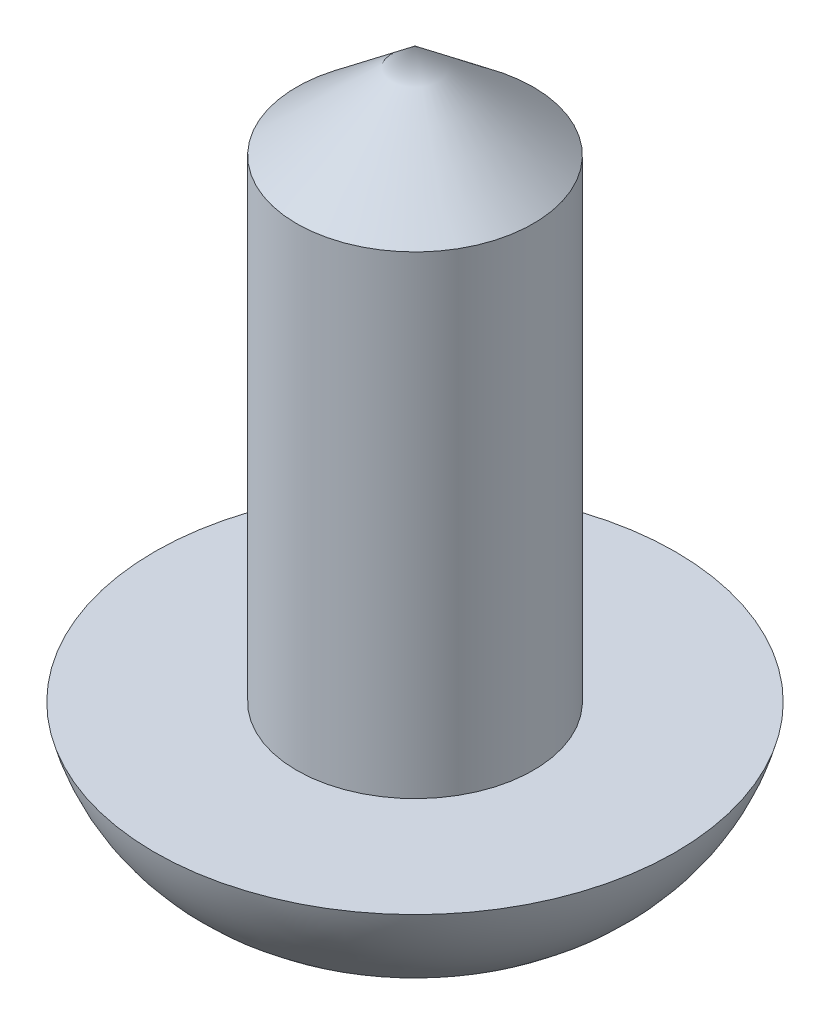
from build123d import *

# Parameters (mm, degrees)
SKETCH1_R           = 1.25
BOSS_EXTRUDE1_DEPTH = 5
SKETCH2_R           = 2.75
BOSS_EXTRUDE2_DEPTH = 1.5
FILLET1_R           = 2
CUT_EXTRUDE1_DEPTH  = 1
CUT_EXTRUDE1_DRAFT  = -15


with BuildPart() as part:
    # Sketch1 → Boss-Extrude1 (new body)
    with BuildSketch(Plane(origin=(0, 0, 0), x_dir=(1, 0, 0), z_dir=(0, 1, 0))):
        with Locations(Location((0, 0, 0), (0, 0, 270))):
            Circle(SKETCH1_R)
    extrude(amount=BOSS_EXTRUDE1_DEPTH)

    # Sketch2 → Boss-Extrude2 (add)
    with BuildSketch(Plane.XZ):
        with Locations(Location((0, 0, 0), (0, 0, 270))):
            Circle(SKETCH2_R)
    extrude(amount=BOSS_EXTRUDE2_DEPTH)

    # Fillet1
    # the kernel refuses this fillet: 2 mm, written as the material it takes off along each edge
    with BuildSketch(Plane(origin=(0, -1.5, 0), x_dir=(0, 0, -1), z_dir=(-1, 0, 0))) as fillet1_piece_1:
        with BuildLine():
            CenterArc((0.813508327, -2), FILLET1_R, 14.477512186, 75.522487814)
            Line((0.813508327, 0), (0.813508327, 0.04))
            Line((0.813508327, 0.04), (2.75, 0.04))
            Line((2.75, 0.04), (2.79, 0))
            ThreePointArc((2.79, 0), (2.79, -0.75), (2.788729833, -1.49))
            Line((2.788729833, -1.49), (2.75, -1.5))
        make_face()
    revolve(axis=Axis((0, -1.5, 0), (0, -1, 0)), mode=Mode.SUBTRACT)


with BuildPart() as cut_extrude1_tool:
    # Sketch3 → Cut-Extrude1 (with draft: the straight prism first)
    with BuildSketch(Plane.XZ.offset(1.5)):
        Polygon((0.375, 0.375), (0.375, 1.5), (-0.375, 1.5), (-0.375, 0.375), (-1.5, 0.375), (-1.5, -0.375), (-0.375, -0.375), (-0.375, -1.5), (0.375, -1.5), (0.375, -0.375), (1.5, -0.375), (1.5, 0.375), align=None)
    extrude(amount=-CUT_EXTRUDE1_DEPTH)
    # Cut-Extrude1: the draft: its side faces are tilted about the plane it starts from
    cut_extrude1_sides = [cut_extrude1_tool.faces().sort_by_distance(p)[0] for p in [
        (0.375, -1, 0.9375),
        (0, -1, 1.5),
        (-0.375, -1, 0.9375),
        (-0.9375, -1, 0.375),
        (-1.5, -1, 0),
        (-0.9375, -1, -0.375),
        (-0.375, -1, -0.9375),
        (0, -1, -1.5),
        (0.375, -1, -0.9375),
        (0.9375, -1, -0.375),
        (1.5, -1, 0),
        (0.9375, -1, 0.375),
    ]]
    draft(cut_extrude1_sides, Plane.XZ.offset(1.5), CUT_EXTRUDE1_DRAFT)


with BuildPart() as part_1:
    add(part.part)

    # Cut-Extrude1: cut by cut_extrude1_tool
    add(cut_extrude1_tool.part, mode=Mode.SUBTRACT)

    # Sketch11 → Revolve2 (revolve)
    with BuildSketch(Plane.XY, mode=Mode.PRIVATE) as revolve2_sk:
        Polygon((0, 5), (0, 6), (-1.25, 5), align=None)
    revolve(revolve2_sk.sketch.rotate(Axis((0, 5, 0), (0, 1, 0)), 103.11828208), axis=Axis((0, 5, 0), (0, 1, 0)))


solid = part_1.part
